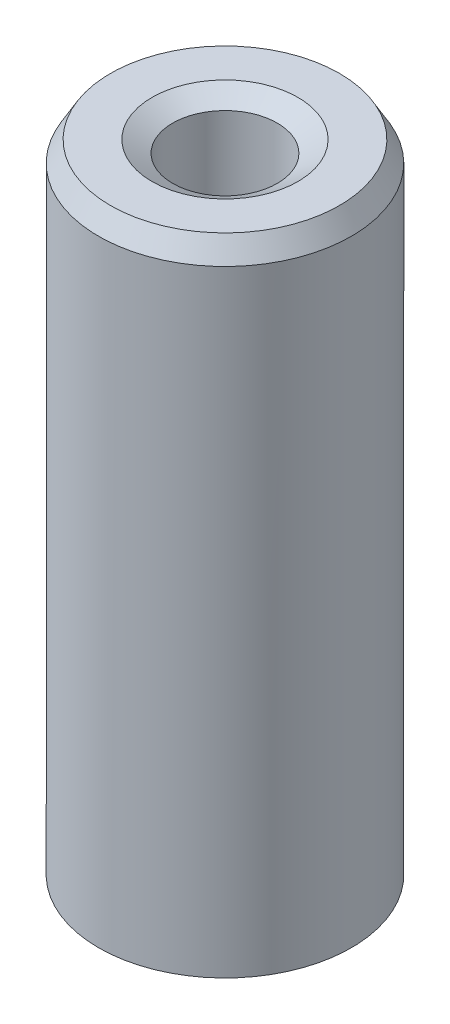
from build123d import *
from OCP.BRepFilletAPI import BRepFilletAPI_MakeChamfer

# Parameters (mm, degrees)
SKETCH1_R           = 20
BOSS_EXTRUDE1_DEPTH = 102.632128628
SKETCH2_R           = 8.272713192
CUT_EXTRUDE1_DEPTH  = 107.458225735
CHAMFER1_SIZE       = 3.266894173
CHAMFER1_SIZE2      = 1.88614223


with BuildPart() as part:
    # Sketch1 → Boss-Extrude1 (new body)
    with BuildSketch(Plane(origin=(0, 0, 0), x_dir=(1, 0, 0), z_dir=(0, 1, 0))):
        Circle(SKETCH1_R)
    extrude(amount=BOSS_EXTRUDE1_DEPTH)

    # Sketch2 → Cut-Extrude1 (cut, through all)
    with BuildSketch(Plane(origin=(0, 0, 0), x_dir=(1, 0, 0), z_dir=(0, 1, 0))):
        Circle(SKETCH2_R)
    extrude(amount=CUT_EXTRUDE1_DEPTH, mode=Mode.SUBTRACT)

    # Chamfer1: one chamfer whose edges measure the first distance from different faces: ONE call of the kernel's chamfer builder (chamfer() names one face for all edges)
    chamfer1_edges_1 = [part.edges().sort_by_distance(p)[0] for p in [
        (-8.272713192, 102.632128628, 0),
    ]]
    chamfer1_side_1 = [part.faces().sort_by_distance(p)[0] for p in [
        (-19.434314575, 102.632128628, 0),
    ]]
    chamfer1_edges_2 = [part.edges().sort_by_distance(p)[0] for p in [
        (-8.272713192, 0, 0),
    ]]
    chamfer1_side_2 = [part.faces().sort_by_distance(p)[0] for p in [
        (-8.272713192, 51.316064314, 0),
    ]]
    chamfer1_edges_3 = [part.edges().sort_by_distance(p)[0] for p in [
        (-20, 0, 0),
    ]]
    chamfer1_side_3 = [part.faces().sort_by_distance(p)[0] for p in [
        (-19.434314575, 0, 0),
    ]]
    chamfer1_edges_4 = [part.edges().sort_by_distance(p)[0] for p in [
        (-20, 102.632128628, 0),
    ]]
    chamfer1_side_4 = [part.faces().sort_by_distance(p)[0] for p in [
        (-20, 51.316064314, 0),
    ]]
    chamfer1 = BRepFilletAPI_MakeChamfer(part.part.solid().wrapped)
    for e in chamfer1_edges_1:
        chamfer1.Add(CHAMFER1_SIZE, CHAMFER1_SIZE2, e.wrapped, chamfer1_side_1[0].wrapped)  # the first distance lies on this face
    for e in chamfer1_edges_2:
        chamfer1.Add(CHAMFER1_SIZE, CHAMFER1_SIZE2, e.wrapped, chamfer1_side_2[0].wrapped)  # the first distance lies on this face
    for e in chamfer1_edges_3:
        chamfer1.Add(CHAMFER1_SIZE, CHAMFER1_SIZE2, e.wrapped, chamfer1_side_3[0].wrapped)  # the first distance lies on this face
    for e in chamfer1_edges_4:
        chamfer1.Add(CHAMFER1_SIZE, CHAMFER1_SIZE2, e.wrapped, chamfer1_side_4[0].wrapped)  # the first distance lies on this face
    add(Compound.cast(chamfer1.Shape()), mode=Mode.REPLACE)


solid = part.part
